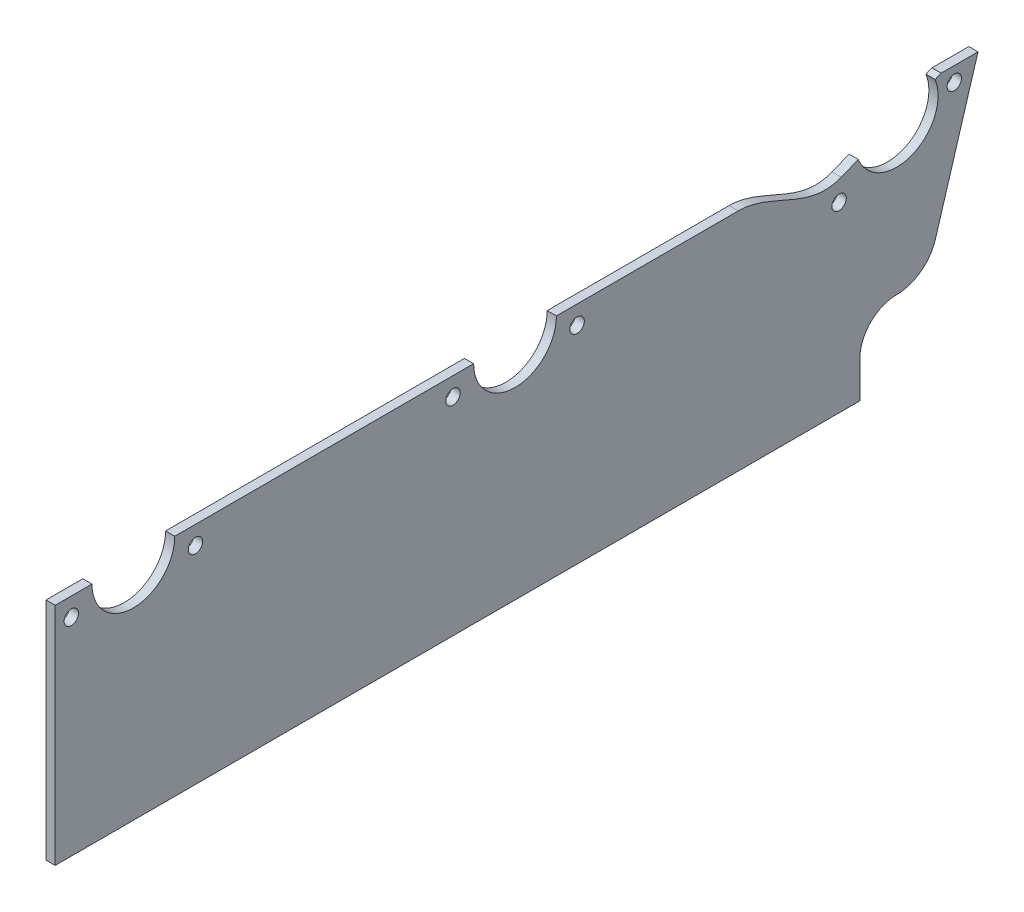
from build123d import *

# Parameters (mm, degrees)
BOSS_EXTRUDE1_DEPTH    = 3.175
F_10_CLEARANCE_HOLE1_D = 4.9784


with BuildPart() as part:
    # Sketch1 → Boss-Extrude1 (new body)
    with BuildSketch(Plane(origin=(0, 0, 0), x_dir=(0, 0, -1), z_dir=(1, 0, 0))):
        with BuildLine():
            Line((-12.7, -12.7), (-290.5125, -12.7))
            Line((-290.5125, -12.7), (-290.5125, 65.0875))
            Line((-290.5125, 65.0875), (-277.8125, 65.0875))
            ThreePointArc((-277.8125, 65.0875), (-263.525, 50.8), (-249.2375, 65.0875))
            Line((-249.2375, 65.0875), (-146.05, 65.0875))
            ThreePointArc((-146.05, 65.0875), (-131.7625, 50.8), (-117.475, 65.0875))
            Line((-117.475, 65.0875), (-54.702453933, 65.0875))
            add(Edge.make_bspline(
                [(-19.151627391, 57.398444498), (-30.900519099, 52.681462563), (-42.5781769, 65.0875), (-54.702453933, 65.0875)],
                knots=[0, 0, 0, 0, 1, 1, 1, 1], degree=3))
            Line((-19.151627391, 57.398444498), (-13.258818963, 59.764307729))
            ThreePointArc((-13.258818963, 59.764307729), (5.323192271, 51.828681037), (13.258818963, 70.410692271))
            Line((13.258818963, 70.410692271), (15.367388207, 71.257247271))
            Line((15.367388207, 71.257247271), (28.067388207, 71.257247271))
            Line((28.067388207, 71.257247271), (13.372773255, 22.628980888))
            ThreePointArc((13.372773255, 22.628980888), (8.327900786, 15.453629442), (0, 12.7))
            ThreePointArc((0, 12.7), (-8.980256121, 8.980256121), (-12.7, 0))
            Line((-12.7, 0), (-12.7, -12.7))
        make_face()
    extrude(amount=BOSS_EXTRUDE1_DEPTH)

    # #10 Clearance Hole1 (through all)
    with Locations(Plane(origin=(3.175, 0, 0), x_dir=(0, 0, -1), z_dir=(1, 0, 0))):
        with Locations((-284.95625, 58.7375), (-242.09375, 58.7375), (-153.19375, 58.7375), (-110.33125, 58.7375), (-19.888228445, 50.260048967), (19.888228445, 66.229625779)):
            Hole(F_10_CLEARANCE_HOLE1_D / 2)


solid = part.part
